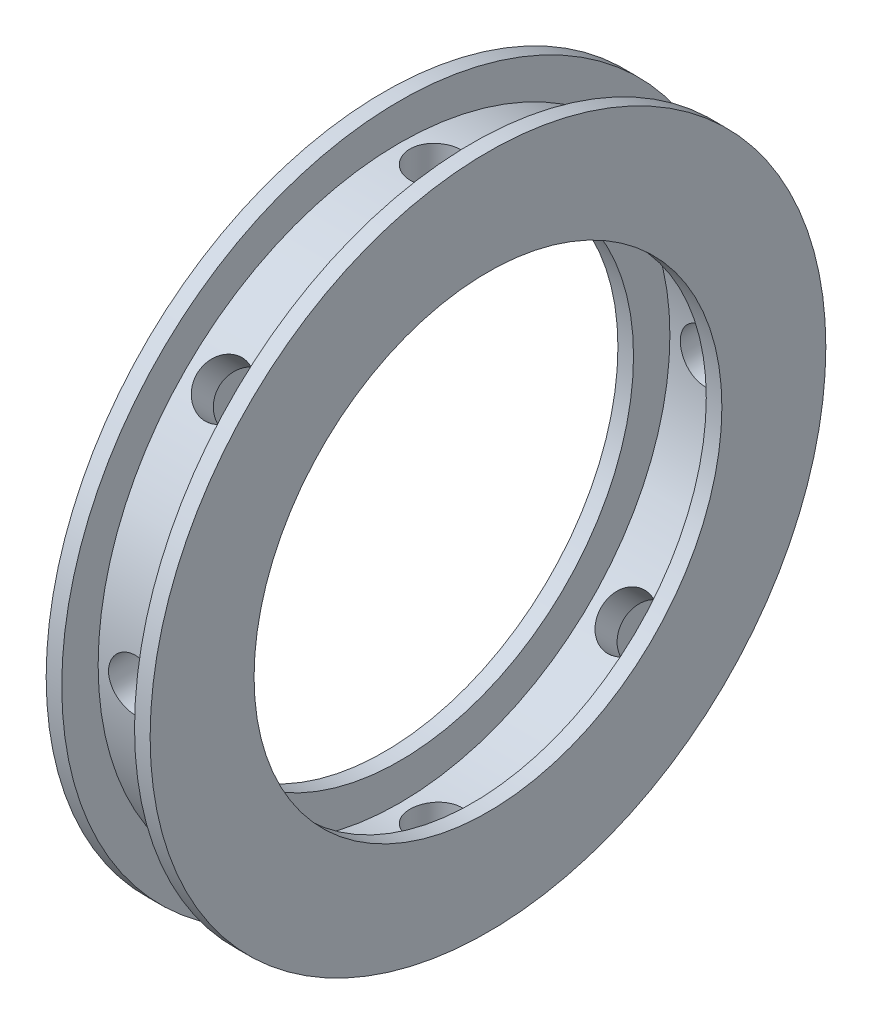
from build123d import *

# Parameters (mm, degrees)
CUT_EXTRUDE1_START = 25
CUT_EXTRUDE1_DEPTH = 5
CIRPATTERN1_COUNT  = 8


with BuildPart() as part:
    # Sketch1 → Revolve1 (revolve)
    with BuildSketch(Plane.XY, mode=Mode.PRIVATE) as revolve1_sk:
        Polygon((-3.5, -29), (3.5, -29), (3.5, -32.5), (5, -32.5), (5, -22.5), (3.5, -22.5), (3.5, -26), (-3.5, -26), (-3.5, -22.5), (-5, -22.5), (-5, -32.5), (-3.5, -32.5), align=None)
    revolve(revolve1_sk.sketch.rotate(Axis((-17.746788991, 0, 0), (1, 0, 0)), 270), axis=Axis((-17.746788991, 0, 0), (1, 0, 0)))

    # Cut-Extrude1: read off the stored shape, not the designer's step
    # Cut-Extrude1 outline → Cut-Extrude1 (cut)
    with BuildSketch(Plane(origin=(0, 0, 0), x_dir=(1, 0, 0), z_dir=(0, 1, 0)).offset(CUT_EXTRUDE1_START)):
        with BuildLine():
            add(Edge.make_bspline(
                [(0, 2.5), (0.660976734, 2.5), (1.306945578, 2.228678657), (2.228934725, 1.306508818), (2.499645651, 0.653846622), (2.500353613, -0.651134085), (2.235136363, -1.299973748), (1.302000779, -2.233956194), (0.653649632, -2.499762264), (-0.65182984, -2.500237405), (-1.304655826, -2.229986434), (-2.227463307, -1.30895895), (-2.499357718, -0.662748929), (-2.500639925, 0.657894454), (-2.229979493, 1.304824898), (-1.308345408, 2.227915808), (-0.660976734, 2.5), (0, 2.5)],
                knots=[0, 0, 0, 0, 0.125, 0.125, 0.25, 0.25, 0.375, 0.375, 0.5, 0.5, 0.625, 0.625, 0.75, 0.75, 0.875, 0.875, 1, 1, 1, 1], degree=3))
        make_face()
    cut_extrude1 = extrude(amount=CUT_EXTRUDE1_DEPTH, mode=Mode.SUBTRACT)

    # CirPattern1: Cut-Extrude1 ×8 about axis
    cirpattern1_axis = Axis((-17.746788991, 0, 0), (-1, 0, 0))
    for i in range(1, CIRPATTERN1_COUNT):
        add(cut_extrude1.rotate(cirpattern1_axis, i * 360 / CIRPATTERN1_COUNT), mode=Mode.SUBTRACT)


solid = part.part
